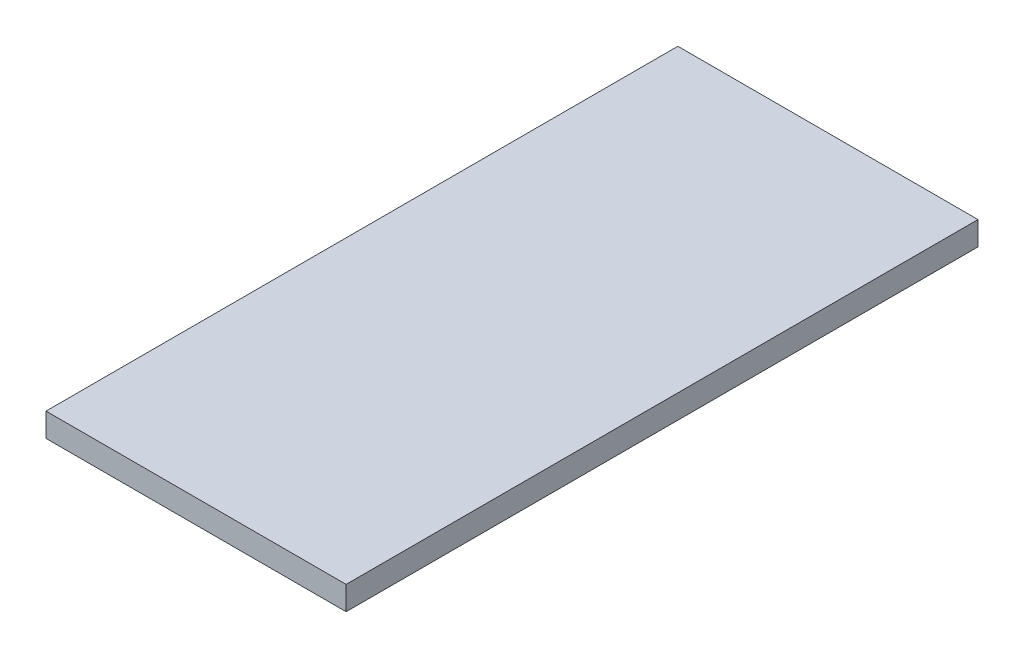
from build123d import *

# Parameters (mm, degrees)
SKETCH1_W           = 241.3
SKETCH1_H           = 508
BOSS_EXTRUDE1_DEPTH = 9.525


with BuildPart() as part:
    # Sketch1 → Boss-Extrude1 (new, symmetric)
    with BuildSketch(Plane(origin=(0, 0, 0), x_dir=(1, 0, 0), z_dir=(0, 1, 0))):
        Rectangle(SKETCH1_W, SKETCH1_H)
    extrude(amount=BOSS_EXTRUDE1_DEPTH, both=True)


solid = part.part
